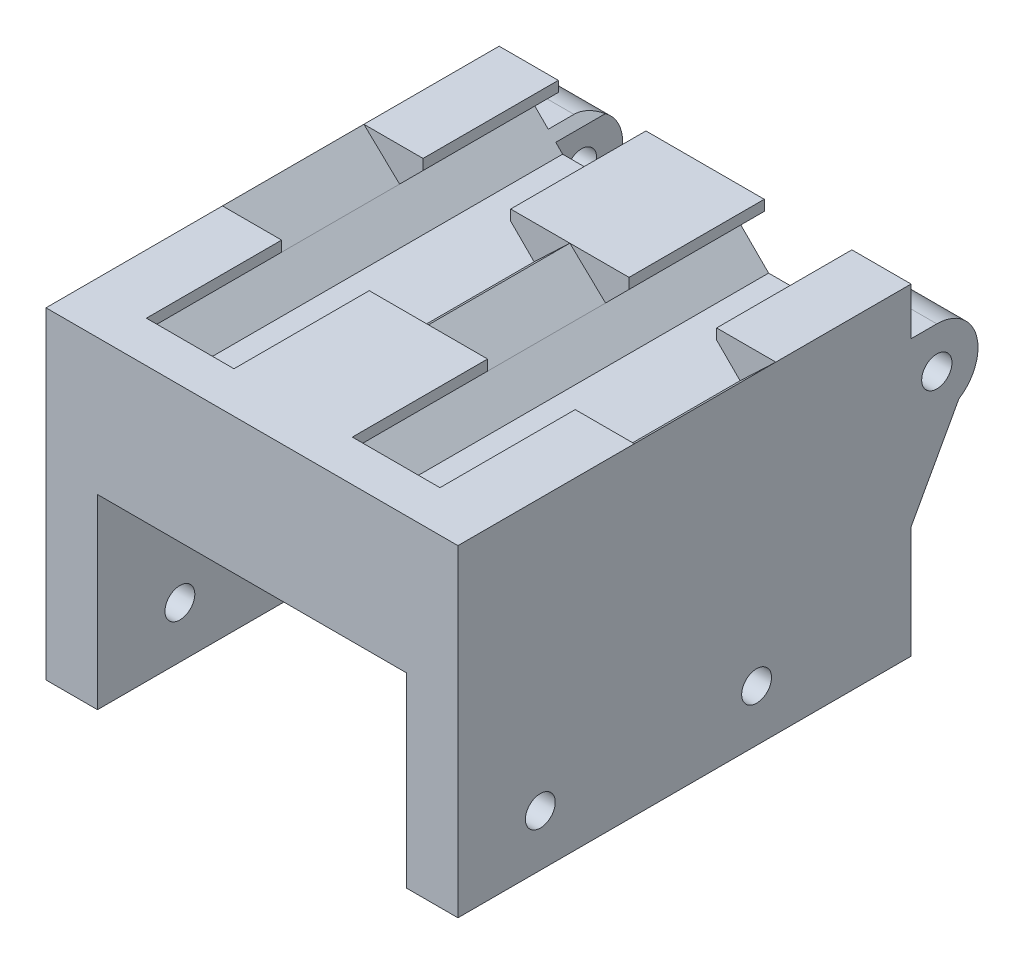
from build123d import *

# Parameters (mm, degrees)
BOSS_EXTRUDE1_DEPTH     = 40
SKETCH2_W               = 13.73333333
SKETCH2_H               = 6
CUT_EXTRUDE1_DEPTH      = 58.827329179
SKETCH3_W               = 40
SKETCH3_H               = 11.8
BOSS_EXTRUDE2_DEPTH     = 4
BOSS_EXTRUDE3_DEPTH     = 13.73333333
SKETCH10_R              = 1.47
BOSS_EXTRUDE7_DEPTH     = 5.5
SKETCH13_W              = 40
SKETCH13_H              = 44
BOSS_EXTRUDE8_DEPTH     = 19.5
CHAMFER2_START          = -20
CHAMFER2_DEPTH          = 5.5
EXTRUDE_THIN1_START     = -3
SKETCH14_R              = 9.05
SKETCH14_R_2            = 6.05
EXTRUDE_THIN1_DEPTH     = 8
BOSS_EXTRUDE9_START     = 3
BOSS_EXTRUDE9_DEPTH     = 3
FILLET1_START           = -31.5
FILLET1_DEPTH           = 11
SKETCH16_W              = 30
SKETCH16_H              = 18.101031733
CUT_EXTRUDE4_DEPTH      = 37.5
CHAMFER1_SIZE           = 14
CHAMFER1_SIZE2          = 18.1
SKETCH17_R              = 1.45
CUT_EXTRUDE5_DEPTH      = 35
SKETCH18_R              = 6.05
CUT_EXTRUDE6_DEPTH      = 16
FILLET2_R               = 0.6
CUT_EXTRUDE7_DEPTH      = 58.690987254
CUT_EXTRUDE7_DEPTH_BACK = 10


with BuildPart() as part:
    # Sketch1 → Boss-Extrude1 (new body)
    with BuildSketch(Plane.XY):
        Polygon((-20, -0.2), (-20, -12), (20, -12), (20, -0.2), (14.253501692, -0.2), (14.253501692, -1.22065898), (16.532842712, -3.5), (13.832842712, -6.2), (6.167157288, -6.2), (3.467157288, -3.5), (5.746498308, -1.22065898), (5.746498308, -0.2), (-5.746498308, -0.2), (-5.746498308, -1.22065898), (-3.467157288, -3.5), (-6.167157288, -6.2), (-13.832842712, -6.2), (-16.532842712, -3.5), (-14.253501692, -1.22065898), (-14.253501692, -0.2), align=None)
    extrude(amount=-BOSS_EXTRUDE1_DEPTH)

    # Sketch2 → Cut-Extrude1 (cut, through all)
    with BuildSketch(Plane.ZY.offset(20)):
        with Locations((-20, -3.2)):
            Rectangle(SKETCH2_W, SKETCH2_H)
    extrude(amount=-CUT_EXTRUDE1_DEPTH, mode=Mode.SUBTRACT)

    # Sketch3 → Boss-Extrude2 (add)
    with BuildSketch(Plane.XY):
        with Locations((0, -6.1)):
            Rectangle(SKETCH3_W, SKETCH3_H)
    extrude(amount=BOSS_EXTRUDE2_DEPTH)

    # Sketch4 → Boss-Extrude3 (add)
    with BuildSketch(Plane.XY.offset(-26.866666665)):
        Polygon((-20, -0.2), (-20, -6.2), (-13.832842712, -6.2), (-16.532842712, -3.5), align=None)
        Polygon((-6.167157288, -6.2), (6.167157288, -6.2), (3.467157288, -3.5), (0, -0.2), (-3.467157288, -3.5), align=None)
        Polygon((13.832842712, -6.2), (20, -6.2), (20, -0.2), (16.532842712, -3.5), align=None)
    extrude(amount=BOSS_EXTRUDE3_DEPTH)

    # Sketch10 → Boss-Extrude7 (add)
    with BuildSketch(Plane.ZY.offset(20)):
        with BuildLine():
            Line((-40, -12.8), (-42.5, -12.8))
            ThreePointArc((-42.5, -12.8), (-46.5, -8.8), (-42.5, -4.8))
            Line((-42.5, -4.8), (-40, -4.8))
            ThreePointArc((-40, -4.8), (-36, -8.8), (-40, -12.8))
        make_face()
        with Locations((-42.5, -8.8)):
            Circle(SKETCH10_R, mode=Mode.SUBTRACT)
    boss_extrude7 = extrude(amount=-BOSS_EXTRUDE7_DEPTH)

    # Sketch13 → Boss-Extrude8 (add)
    with BuildSketch(Plane.XZ.offset(12)):
        with Locations((0, -18)):
            Rectangle(SKETCH13_W, SKETCH13_H)
    extrude(amount=BOSS_EXTRUDE8_DEPTH)

    # Chamfer2: read off the stored shape, not the designer's step
    # Chamfer2 outline → Chamfer2 (add)
    with BuildSketch(Plane.YZ.offset(CHAMFER2_START)):
        with BuildLine():
            Line((-20.621590418, -40), (-12.177597262, -44.642857143))
            ThreePointArc((-12.177597262, -44.642857143), (-12.641249084, -43.615708508), (-12.8, -42.5))
            Line((-12.8, -42.5), (-12.8, -40))
            Line((-12.8, -40), (-20.621590418, -40))
        make_face()
    chamfer2 = extrude(amount=CHAMFER2_DEPTH)

    # Mirror1: Boss-Extrude7, Chamfer2 across plane
    add(boss_extrude7.mirror(Plane(origin=(0, 0, 0), x_dir=(0, 0, 1), z_dir=(1, 0, 0))))
    add(chamfer2.mirror(Plane(origin=(0, 0, 0), x_dir=(0, 0, 1), z_dir=(1, 0, 0))))

    # Sketch14 → Extrude-Thin1 (add)
    with BuildSketch(Plane.XZ.offset(31.5).offset(EXTRUDE_THIN1_START)):
        with Locations((-0.2, -42.5)):
            Circle(SKETCH14_R)
        with Locations((-0.2, -42.5)):
            Circle(SKETCH14_R_2, mode=Mode.SUBTRACT)
    extrude(amount=-EXTRUDE_THIN1_DEPTH)

    # Sketch15 → Boss-Extrude9 (add)
    with BuildSketch(Plane.XZ.offset(28.5).offset(BOSS_EXTRUDE9_START)):
        with BuildLine():
            Line((8.497844561, -40), (-8.897844561, -40))
            ThreePointArc((-8.897844561, -40), (-0.2, -51.55), (8.497844561, -40))
        make_face()
    extrude(amount=-BOSS_EXTRUDE9_DEPTH)

    # Fillet1: read off the stored shape, not the designer's step
    # Fillet1 outline → Fillet1 (add)
    with BuildSketch(Plane(origin=(0, 0, 0), x_dir=(1, 0, 0), z_dir=(0, 1, 0)).offset(FILLET1_START)):
        with BuildLine():
            ThreePointArc((20, 40), (12.845609752, 42.00741501), (7.532507128, 47.202215809))
            ThreePointArc((7.532507128, 47.202215809), (8.769787751, 43.7022511), (8.497844561, 40))
            Line((8.497844561, 40), (20, 40))
        make_face()
        with BuildLine():
            ThreePointArc((-8.897844561, 40), (-9.170229006, 43.698954374), (-7.935961427, 47.196530719))
            ThreePointArc((-7.935961427, 47.196530719), (-13.07347783, 42.098748758), (-20, 40))
            Line((-20, 40), (-8.897844561, 40))
        make_face()
    extrude(amount=FILLET1_DEPTH)

    # Sketch16 → Cut-Extrude4 (cut)
    with BuildSketch(Plane.XY.offset(4)):
        with Locations((0, -22.449484134)):
            Rectangle(SKETCH16_W, SKETCH16_H)
    extrude(amount=-CUT_EXTRUDE4_DEPTH, mode=Mode.SUBTRACT)

    # Chamfer1
    chamfer1_edges = [part.edges().sort_by_distance(p)[0] for p in [
        (0, -13.398968267, -33.5),
    ]]
    chamfer1_side = [part.faces().sort_by_distance(p)[0] for p in [
        (0, -13.398968267, -14.75),
    ]]
    chamfer(chamfer1_edges, length=CHAMFER1_SIZE, length2=CHAMFER1_SIZE2, reference=chamfer1_side[0])

    # Sketch17 → Cut-Extrude5 (cut)
    with BuildSketch(Plane.ZY.offset(20)):
        with Locations((-4, -26.5)):
            Circle(SKETCH17_R)
        with Locations((-25, -26.5)):
            Circle(SKETCH17_R)
    cut_extrude5 = extrude(amount=-CUT_EXTRUDE5_DEPTH, mode=Mode.SUBTRACT)

    # Mirror3: Cut-Extrude5 across plane
    add(cut_extrude5.mirror(Plane(origin=(0, 0, 0), x_dir=(0, 0, 1), z_dir=(1, 0, 0))), mode=Mode.SUBTRACT)

    # Sketch18 → Cut-Extrude6 (cut)
    with BuildSketch(Plane(origin=(0, -28.5, 0), x_dir=(1, 0, 0), z_dir=(0, 1, 0))):
        with Locations(Location((-0.2, 42.5, 0), (0, 0, 90))):
            Circle(SKETCH18_R)
    extrude(amount=CUT_EXTRUDE6_DEPTH, mode=Mode.SUBTRACT)

    # Fillet2
    fillet2_edges = [part.edges().sort_by_distance(p)[0] for p in [
        (16.695998577, -20.5, -40.066855447),
        (-16.826940077, -20.5, -40.066855447),
    ]]
    fillet(fillet2_edges, radius=FILLET2_R)

    # Sketch19 → Cut-Extrude7 (cut, two sides: drawn at the far end of the back side and taken through both)
    with BuildSketch(Plane(origin=(0, 0, -40), x_dir=(-1, 0, 0), z_dir=(0, 0, -1)).offset(-CUT_EXTRUDE7_DEPTH_BACK)):
        Polygon((16.532842712, -3.5), (15.232842712, -4.8), (14.5, -5.532842712), (13.832842712, -6.2), (10, -6.2), (10, -3.5), align=None)
        Polygon((-13.832842712, -6.2), (-14.5, -5.532842712), (-15.232842712, -4.8), (-16.532842712, -3.5), (-10, -3.5), (-10, -6.2), align=None)
    extrude(amount=CUT_EXTRUDE7_DEPTH + CUT_EXTRUDE7_DEPTH_BACK, mode=Mode.SUBTRACT)


solid = part.part
